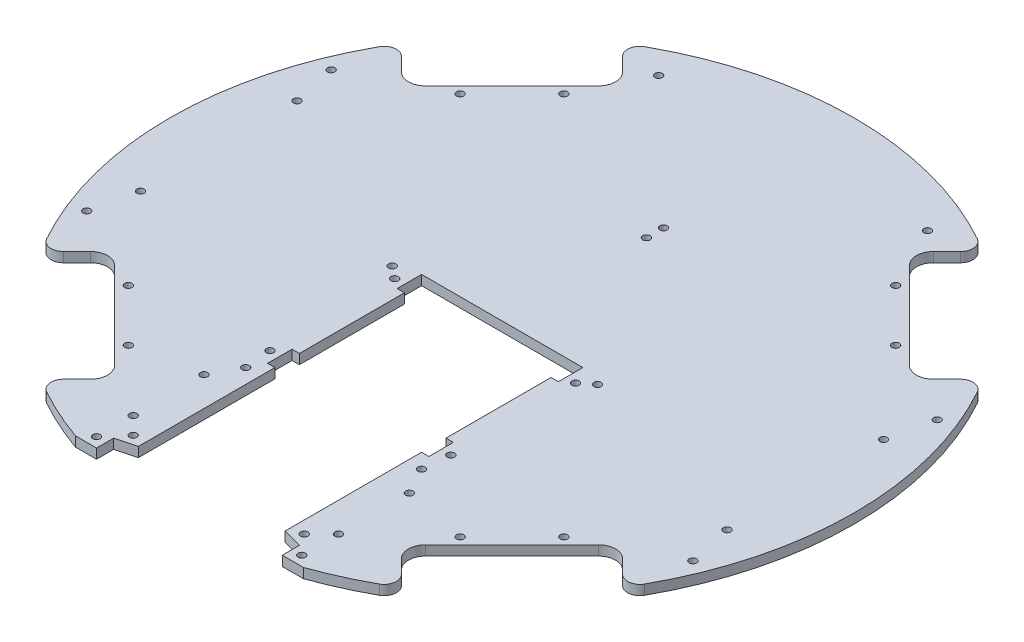
from build123d import *

# Parameters (mm, degrees)
SKETCH1_R                = 140
BOSS_EXTRUDE1_DEPTH      = 4
CUT_EXTRUDE4_REACH       = 200.03
CUT_EXTRUDE6_REACH       = 200.03
SKETCH9_R                = 1.5
FILLET1_R                = 5
CIRPATTERN1_COUNT        = 4
FILLET1_OF_CIRPATTERN1_R = 5
CUT_EXTRUDE1_REACH       = 200.03
FILLET3_R                = 1.5
CUT_EXTRUDE7_REACH       = 200.03
SKETCH10_R               = 1.5
CUT_EXTRUDE9_REACH       = 200.03
SKETCH13_R               = 1.5
CUT_EXTRUDE12_REACH      = 200.03
SKETCH16_R               = 1.5
CUT_EXTRUDE13_REACH      = 200.03
SKETCH17_R               = 1.5
CUT_EXTRUDE15_REACH      = 200.03
SKETCH19_R               = 1.5
CUT_EXTRUDE17_REACH      = 200.03
SKETCH21_R               = 1.5
CUT_EXTRUDE18_REACH      = 200.03
SKETCH22_R               = 1.5
CUT_EXTRUDE19_REACH      = 200.03
SKETCH23_R               = 1.5


with BuildPart() as part:
    # Sketch1 → Boss-Extrude1 (new body)
    with BuildSketch(Plane(origin=(0, 0, 0), x_dir=(1, 0, 0), z_dir=(0, 1, 0))):
        Circle(SKETCH1_R)
    extrude(amount=BOSS_EXTRUDE1_DEPTH)

    # Sketch7 → Cut-Extrude4 (cut, up to next)
    with BuildSketch(Plane(origin=(0, 4, 0), x_dir=(1, 0, 0), z_dir=(0, 1, 0)), mode=Mode.PRIVATE) as cut_extrude4_sk1:
        with BuildLine():
            Line((-99.030304705, -63.604254968), (-63.604254968, -99.030304705))
            ThreePointArc((-63.604254968, -99.030304705), (-61.568647097, -103.944696834), (-63.604254968, -108.859088964))
            Line((-63.604254968, -108.859088964), (-76.367532368, -121.622366364))
            Line((-76.367532368, -121.622366364), (-121.622366364, -76.367532368))
            Line((-121.622366364, -76.367532368), (-108.859088964, -63.604254968))
            ThreePointArc((-108.859088964, -63.604254968), (-103.944696834, -61.568647097), (-99.030304705, -63.604254968))
        make_face()
    cut_extrude4_tool1 = extrude(cut_extrude4_sk1.sketch, amount=-CUT_EXTRUDE4_REACH, mode=Mode.PRIVATE) & part.part
    cut_extrude4 = cut_extrude4_tool1.solids().sort_by_distance((-90.257735, 4, 90.257735))[0]
    add(cut_extrude4, mode=Mode.SUBTRACT)

    # Sketch9 → Cut-Extrude6 (cut, up to next)
    with BuildSketch(Plane(origin=(0, 4, 0), x_dir=(1, 0, 0), z_dir=(0, 1, 0)), mode=Mode.PRIVATE) as cut_extrude6_sk1:
        with Locations((-89.09545443, -67.882250994)):
            Circle(SKETCH9_R)
    cut_extrude6_tool1 = extrude(cut_extrude6_sk1.sketch, amount=-CUT_EXTRUDE6_REACH, mode=Mode.PRIVATE) & part.part
    # Sketch9 → Cut-Extrude6 (cut, up to next)
    with BuildSketch(Plane(origin=(0, 4, 0), x_dir=(1, 0, 0), z_dir=(0, 1, 0)), mode=Mode.PRIVATE) as cut_extrude6_sk2:
        with Locations((-67.882250994, -89.09545443)):
            Circle(SKETCH9_R)
    cut_extrude6_tool2 = extrude(cut_extrude6_sk2.sketch, amount=-CUT_EXTRUDE6_REACH, mode=Mode.PRIVATE) & part.part
    cut_extrude6_1 = cut_extrude6_tool1.solids().sort_by_distance((-89.095454, 4, 67.882251))[0]
    add(cut_extrude6_1, mode=Mode.SUBTRACT)
    cut_extrude6_2 = cut_extrude6_tool2.solids().sort_by_distance((-67.882251, 4, 89.095454))[0]
    add(cut_extrude6_2, mode=Mode.SUBTRACT)
    cut_extrude6 = cut_extrude6_1 + cut_extrude6_2  # Cut-Extrude6 as one shape, for the pattern or mirror that repeats it

    # Fillet1
    fillet1_edges = [part.edges().sort_by_distance(p)[0] for p in [
        (-73.746853427, 2, 119.001687423),
        (-119.001687423, 2, 73.746853427),
    ]]
    fillet(fillet1_edges, radius=FILLET1_R)

    # CirPattern1: Cut-Extrude4, Cut-Extrude6 ×4 about axis
    cirpattern1_axis = Axis((0, 4, 0), (0, 1, 0))
    add([cut_extrude4.rotate(cirpattern1_axis, i * 360 / CIRPATTERN1_COUNT) for i in range(1, CIRPATTERN1_COUNT)], mode=Mode.SUBTRACT)
    add([cut_extrude6.rotate(cirpattern1_axis, i * 360 / CIRPATTERN1_COUNT) for i in range(1, CIRPATTERN1_COUNT)], mode=Mode.SUBTRACT)

    # Fillet1 of CirPattern1
    fillet1_of_cirpattern1_edges = [part.edges().sort_by_distance(p)[0] for p in [
        (119.001687423, 2, 73.746853427),
        (73.746853427, 2, 119.001687423),
        (73.746853427, 2, -119.001687423),
        (119.001687423, 2, -73.746853427),
        (-119.001687423, 2, -73.746853427),
        (-73.746853427, 2, -119.001687423),
    ]]
    fillet(fillet1_of_cirpattern1_edges, radius=FILLET1_OF_CIRPATTERN1_R)

    # Sketch2 → Cut-Extrude1 (cut, up to next)
    with BuildSketch(Plane(origin=(0, 4, 0), x_dir=(1, 0, 0), z_dir=(0, 1, 0)), mode=Mode.PRIVATE) as cut_extrude1_sk1:
        Polygon((-46.647615159, -132), (-38, -132), (-38, -125), (-30, -122.856406461), (-30, -67), (-33, -67), (-33, -57), (-30, -57), (-30, -14), (-33, -14), (-33, -4), (33, -4), (33, -14), (30, -14), (30, -57), (33, -57), (33, -67), (30, -67), (30, -122.856406461), (38, -125), (38, -132), (46.647615159, -132), (46.647615159, -140), (-46.647615159, -140), align=None)
    cut_extrude1_tool1 = extrude(cut_extrude1_sk1.sketch, amount=-CUT_EXTRUDE1_REACH, mode=Mode.PRIVATE) & part.part
    add(cut_extrude1_tool1.solids().sort_by_distance((0, 4, 74.292867))[0], mode=Mode.SUBTRACT)

    # Fillet3
    fillet3_edges = [part.edges().sort_by_distance(p)[0] for p in [
        (67.882250994, 0, 90.59545443),
        (89.09545443, 0, 69.382250994),
        (90.59545443, 0, -67.882250994),
        (69.382250994, 0, -89.09545443),
        (-67.882250994, 0, -90.59545443),
        (-89.09545443, 0, -69.382250994),
        (-69.382250994, 0, 89.09545443),
        (-90.59545443, 0, 67.882250994),
    ]]
    fillet(fillet3_edges, radius=FILLET3_R)

    # Sketch10 → Cut-Extrude7 (cut, up to next)
    with BuildSketch(Plane(origin=(0, 4, 0), x_dir=(1, 0, 0), z_dir=(0, 1, 0)), mode=Mode.PRIVATE) as cut_extrude7_sk1:
        with Locations((-37, -62)):
            Circle(SKETCH10_R)
    cut_extrude7_tool1 = extrude(cut_extrude7_sk1.sketch, amount=-CUT_EXTRUDE7_REACH, mode=Mode.PRIVATE) & part.part
    # Sketch10 → Cut-Extrude7 (cut, up to next)
    with BuildSketch(Plane(origin=(0, 4, 0), x_dir=(1, 0, 0), z_dir=(0, 1, 0)), mode=Mode.PRIVATE) as cut_extrude7_sk2:
        with Locations((37, -62)):
            Circle(SKETCH10_R)
    cut_extrude7_tool2 = extrude(cut_extrude7_sk2.sketch, amount=-CUT_EXTRUDE7_REACH, mode=Mode.PRIVATE) & part.part
    # Sketch10 → Cut-Extrude7 (cut, up to next)
    with BuildSketch(Plane(origin=(0, 4, 0), x_dir=(1, 0, 0), z_dir=(0, 1, 0)), mode=Mode.PRIVATE) as cut_extrude7_sk3:
        with Locations((-37, -11)):
            Circle(SKETCH10_R)
    cut_extrude7_tool3 = extrude(cut_extrude7_sk3.sketch, amount=-CUT_EXTRUDE7_REACH, mode=Mode.PRIVATE) & part.part
    # Sketch10 → Cut-Extrude7 (cut, up to next)
    with BuildSketch(Plane(origin=(0, 4, 0), x_dir=(1, 0, 0), z_dir=(0, 1, 0)), mode=Mode.PRIVATE) as cut_extrude7_sk4:
        with Locations((37, -11)):
            Circle(SKETCH10_R)
    cut_extrude7_tool4 = extrude(cut_extrude7_sk4.sketch, amount=-CUT_EXTRUDE7_REACH, mode=Mode.PRIVATE) & part.part
    # Sketch10 → Cut-Extrude7 (cut, up to next)
    with BuildSketch(Plane(origin=(0, 4, 0), x_dir=(1, 0, 0), z_dir=(0, 1, 0)), mode=Mode.PRIVATE) as cut_extrude7_sk5:
        with Locations((-42, -7)):
            Circle(SKETCH10_R)
    cut_extrude7_tool5 = extrude(cut_extrude7_sk5.sketch, amount=-CUT_EXTRUDE7_REACH, mode=Mode.PRIVATE) & part.part
    # Sketch10 → Cut-Extrude7 (cut, up to next)
    with BuildSketch(Plane(origin=(0, 4, 0), x_dir=(1, 0, 0), z_dir=(0, 1, 0)), mode=Mode.PRIVATE) as cut_extrude7_sk6:
        with Locations((42, -7)):
            Circle(SKETCH10_R)
    cut_extrude7_tool6 = extrude(cut_extrude7_sk6.sketch, amount=-CUT_EXTRUDE7_REACH, mode=Mode.PRIVATE) & part.part
    add(cut_extrude7_tool1.solids().sort_by_distance((-37, 4, 62))[0], mode=Mode.SUBTRACT)
    add(cut_extrude7_tool2.solids().sort_by_distance((37, 4, 62))[0], mode=Mode.SUBTRACT)
    add(cut_extrude7_tool3.solids().sort_by_distance((-37, 4, 11))[0], mode=Mode.SUBTRACT)
    add(cut_extrude7_tool4.solids().sort_by_distance((37, 4, 11))[0], mode=Mode.SUBTRACT)
    add(cut_extrude7_tool5.solids().sort_by_distance((-42, 4, 7))[0], mode=Mode.SUBTRACT)
    add(cut_extrude7_tool6.solids().sort_by_distance((42, 4, 7))[0], mode=Mode.SUBTRACT)

    # Sketch13 → Cut-Extrude9 (cut, up to next)
    with BuildSketch(Plane(origin=(0, 4, 0), x_dir=(1, 0, 0), z_dir=(0, 1, 0)), mode=Mode.PRIVATE) as cut_extrude9_sk1:
        with Locations((-42, -84)):
            Circle(SKETCH13_R)
    cut_extrude9_tool1 = extrude(cut_extrude9_sk1.sketch, amount=-CUT_EXTRUDE9_REACH, mode=Mode.PRIVATE) & part.part
    # Sketch13 → Cut-Extrude9 (cut, up to next)
    with BuildSketch(Plane(origin=(0, 4, 0), x_dir=(1, 0, 0), z_dir=(0, 1, 0)), mode=Mode.PRIVATE) as cut_extrude9_sk2:
        with Locations((-42, -113)):
            Circle(SKETCH13_R)
    cut_extrude9_tool2 = extrude(cut_extrude9_sk2.sketch, amount=-CUT_EXTRUDE9_REACH, mode=Mode.PRIVATE) & part.part
    # Sketch13 → Cut-Extrude9 (cut, up to next)
    with BuildSketch(Plane(origin=(0, 4, 0), x_dir=(1, 0, 0), z_dir=(0, 1, 0)), mode=Mode.PRIVATE) as cut_extrude9_sk3:
        with Locations((42, -113)):
            Circle(SKETCH13_R)
    cut_extrude9_tool3 = extrude(cut_extrude9_sk3.sketch, amount=-CUT_EXTRUDE9_REACH, mode=Mode.PRIVATE) & part.part
    # Sketch13 → Cut-Extrude9 (cut, up to next)
    with BuildSketch(Plane(origin=(0, 4, 0), x_dir=(1, 0, 0), z_dir=(0, 1, 0)), mode=Mode.PRIVATE) as cut_extrude9_sk4:
        with Locations((42, -84)):
            Circle(SKETCH13_R)
    cut_extrude9_tool4 = extrude(cut_extrude9_sk4.sketch, amount=-CUT_EXTRUDE9_REACH, mode=Mode.PRIVATE) & part.part
    add(cut_extrude9_tool1.solids().sort_by_distance((-42, 4, 84))[0], mode=Mode.SUBTRACT)
    add(cut_extrude9_tool2.solids().sort_by_distance((-42, 4, 113))[0], mode=Mode.SUBTRACT)
    add(cut_extrude9_tool3.solids().sort_by_distance((42, 4, 113))[0], mode=Mode.SUBTRACT)
    add(cut_extrude9_tool4.solids().sort_by_distance((42, 4, 84))[0], mode=Mode.SUBTRACT)

    # Sketch16 → Cut-Extrude12 (cut, up to next)
    with BuildSketch(Plane(origin=(0, 4, 0), x_dir=(1, 0, 0), z_dir=(0, 1, 0)), mode=Mode.PRIVATE) as cut_extrude12_sk1:
        with Locations((0, 62)):
            Circle(SKETCH16_R)
    cut_extrude12_tool1 = extrude(cut_extrude12_sk1.sketch, amount=-CUT_EXTRUDE12_REACH, mode=Mode.PRIVATE) & part.part
    # Sketch16 → Cut-Extrude12 (cut, up to next)
    with BuildSketch(Plane(origin=(0, 4, 0), x_dir=(1, 0, 0), z_dir=(0, 1, 0)), mode=Mode.PRIVATE) as cut_extrude12_sk2:
        with Locations((0, 55)):
            Circle(SKETCH16_R)
    cut_extrude12_tool2 = extrude(cut_extrude12_sk2.sketch, amount=-CUT_EXTRUDE12_REACH, mode=Mode.PRIVATE) & part.part
    add(cut_extrude12_tool1.solids().sort_by_distance((0, 4, -62))[0], mode=Mode.SUBTRACT)
    add(cut_extrude12_tool2.solids().sort_by_distance((0, 4, -55))[0], mode=Mode.SUBTRACT)

    # Sketch17 → Cut-Extrude13 (cut, up to next)
    with BuildSketch(Plane(origin=(0, 4, 0), x_dir=(1, 0, 0), z_dir=(0, 1, 0)), mode=Mode.PRIVATE) as cut_extrude13_sk1:
        with Locations((-124, 50)):
            Circle(SKETCH17_R)
    cut_extrude13_tool1 = extrude(cut_extrude13_sk1.sketch, amount=-CUT_EXTRUDE13_REACH, mode=Mode.PRIVATE) & part.part
    # Sketch17 → Cut-Extrude13 (cut, up to next)
    with BuildSketch(Plane(origin=(0, 4, 0), x_dir=(1, 0, 0), z_dir=(0, 1, 0)), mode=Mode.PRIVATE) as cut_extrude13_sk2:
        with Locations((-124, -50)):
            Circle(SKETCH17_R)
    cut_extrude13_tool2 = extrude(cut_extrude13_sk2.sketch, amount=-CUT_EXTRUDE13_REACH, mode=Mode.PRIVATE) & part.part
    # Sketch17 → Cut-Extrude13 (cut, up to next)
    with BuildSketch(Plane(origin=(0, 4, 0), x_dir=(1, 0, 0), z_dir=(0, 1, 0)), mode=Mode.PRIVATE) as cut_extrude13_sk3:
        with Locations((124, 50)):
            Circle(SKETCH17_R)
    cut_extrude13_tool3 = extrude(cut_extrude13_sk3.sketch, amount=-CUT_EXTRUDE13_REACH, mode=Mode.PRIVATE) & part.part
    # Sketch17 → Cut-Extrude13 (cut, up to next)
    with BuildSketch(Plane(origin=(0, 4, 0), x_dir=(1, 0, 0), z_dir=(0, 1, 0)), mode=Mode.PRIVATE) as cut_extrude13_sk4:
        with Locations((124, -50)):
            Circle(SKETCH17_R)
    cut_extrude13_tool4 = extrude(cut_extrude13_sk4.sketch, amount=-CUT_EXTRUDE13_REACH, mode=Mode.PRIVATE) & part.part
    add(cut_extrude13_tool1.solids().sort_by_distance((-124, 4, -50))[0], mode=Mode.SUBTRACT)
    add(cut_extrude13_tool2.solids().sort_by_distance((-124, 4, 50))[0], mode=Mode.SUBTRACT)
    add(cut_extrude13_tool3.solids().sort_by_distance((124, 4, -50))[0], mode=Mode.SUBTRACT)
    add(cut_extrude13_tool4.solids().sort_by_distance((124, 4, 50))[0], mode=Mode.SUBTRACT)

    # Sketch19 → Cut-Extrude15 (cut, up to next)
    with BuildSketch(Plane(origin=(0, 4, 0), x_dir=(1, 0, 0), z_dir=(0, 1, 0)), mode=Mode.PRIVATE) as cut_extrude15_sk1:
        with Locations((-42, -128)):
            Circle(SKETCH19_R)
    cut_extrude15_tool1 = extrude(cut_extrude15_sk1.sketch, amount=-CUT_EXTRUDE15_REACH, mode=Mode.PRIVATE) & part.part
    # Sketch19 → Cut-Extrude15 (cut, up to next)
    with BuildSketch(Plane(origin=(0, 4, 0), x_dir=(1, 0, 0), z_dir=(0, 1, 0)), mode=Mode.PRIVATE) as cut_extrude15_sk2:
        with Locations((42, -128)):
            Circle(SKETCH19_R)
    cut_extrude15_tool2 = extrude(cut_extrude15_sk2.sketch, amount=-CUT_EXTRUDE15_REACH, mode=Mode.PRIVATE) & part.part
    add(cut_extrude15_tool1.solids().sort_by_distance((-42, 4, 128))[0], mode=Mode.SUBTRACT)
    add(cut_extrude15_tool2.solids().sort_by_distance((42, 4, 128))[0], mode=Mode.SUBTRACT)

    # Sketch21 → Cut-Extrude17 (cut, up to next)
    with BuildSketch(Plane(origin=(0, 4, 0), x_dir=(1, 0, 0), z_dir=(0, 1, 0)), mode=Mode.PRIVATE) as cut_extrude17_sk1:
        with Locations((-35, -120)):
            Circle(SKETCH21_R)
    cut_extrude17_tool1 = extrude(cut_extrude17_sk1.sketch, amount=-CUT_EXTRUDE17_REACH, mode=Mode.PRIVATE) & part.part
    # Sketch21 → Cut-Extrude17 (cut, up to next)
    with BuildSketch(Plane(origin=(0, 4, 0), x_dir=(1, 0, 0), z_dir=(0, 1, 0)), mode=Mode.PRIVATE) as cut_extrude17_sk2:
        with Locations((-36, -73)):
            Circle(SKETCH21_R)
    cut_extrude17_tool2 = extrude(cut_extrude17_sk2.sketch, amount=-CUT_EXTRUDE17_REACH, mode=Mode.PRIVATE) & part.part
    # Sketch21 → Cut-Extrude17 (cut, up to next)
    with BuildSketch(Plane(origin=(0, 4, 0), x_dir=(1, 0, 0), z_dir=(0, 1, 0)), mode=Mode.PRIVATE) as cut_extrude17_sk3:
        with Locations((35, -120)):
            Circle(SKETCH21_R)
    cut_extrude17_tool3 = extrude(cut_extrude17_sk3.sketch, amount=-CUT_EXTRUDE17_REACH, mode=Mode.PRIVATE) & part.part
    # Sketch21 → Cut-Extrude17 (cut, up to next)
    with BuildSketch(Plane(origin=(0, 4, 0), x_dir=(1, 0, 0), z_dir=(0, 1, 0)), mode=Mode.PRIVATE) as cut_extrude17_sk4:
        with Locations((36, -73)):
            Circle(SKETCH21_R)
    cut_extrude17_tool4 = extrude(cut_extrude17_sk4.sketch, amount=-CUT_EXTRUDE17_REACH, mode=Mode.PRIVATE) & part.part
    add(cut_extrude17_tool1.solids().sort_by_distance((-35, 4, 120))[0], mode=Mode.SUBTRACT)
    add(cut_extrude17_tool2.solids().sort_by_distance((-36, 4, 73))[0], mode=Mode.SUBTRACT)
    add(cut_extrude17_tool3.solids().sort_by_distance((35, 4, 120))[0], mode=Mode.SUBTRACT)
    add(cut_extrude17_tool4.solids().sort_by_distance((36, 4, 73))[0], mode=Mode.SUBTRACT)

    # Sketch22 → Cut-Extrude18 (cut, up to next)
    with BuildSketch(Plane(origin=(0, 4, 0), x_dir=(1, 0, 0), z_dir=(0, 1, 0)), mode=Mode.PRIVATE) as cut_extrude18_sk1:
        with Locations((120, 32)):
            Circle(SKETCH22_R)
    cut_extrude18_tool1 = extrude(cut_extrude18_sk1.sketch, amount=-CUT_EXTRUDE18_REACH, mode=Mode.PRIVATE) & part.part
    # Sketch22 → Cut-Extrude18 (cut, up to next)
    with BuildSketch(Plane(origin=(0, 4, 0), x_dir=(1, 0, 0), z_dir=(0, 1, 0)), mode=Mode.PRIVATE) as cut_extrude18_sk2:
        with Locations((120, -32)):
            Circle(SKETCH22_R)
    cut_extrude18_tool2 = extrude(cut_extrude18_sk2.sketch, amount=-CUT_EXTRUDE18_REACH, mode=Mode.PRIVATE) & part.part
    # Sketch22 → Cut-Extrude18 (cut, up to next)
    with BuildSketch(Plane(origin=(0, 4, 0), x_dir=(1, 0, 0), z_dir=(0, 1, 0)), mode=Mode.PRIVATE) as cut_extrude18_sk3:
        with Locations((-120, 32)):
            Circle(SKETCH22_R)
    cut_extrude18_tool3 = extrude(cut_extrude18_sk3.sketch, amount=-CUT_EXTRUDE18_REACH, mode=Mode.PRIVATE) & part.part
    # Sketch22 → Cut-Extrude18 (cut, up to next)
    with BuildSketch(Plane(origin=(0, 4, 0), x_dir=(1, 0, 0), z_dir=(0, 1, 0)), mode=Mode.PRIVATE) as cut_extrude18_sk4:
        with Locations((-120, -32)):
            Circle(SKETCH22_R)
    cut_extrude18_tool4 = extrude(cut_extrude18_sk4.sketch, amount=-CUT_EXTRUDE18_REACH, mode=Mode.PRIVATE) & part.part
    add(cut_extrude18_tool1.solids().sort_by_distance((120, 4, -32))[0], mode=Mode.SUBTRACT)
    add(cut_extrude18_tool2.solids().sort_by_distance((120, 4, 32))[0], mode=Mode.SUBTRACT)
    add(cut_extrude18_tool3.solids().sort_by_distance((-120, 4, -32))[0], mode=Mode.SUBTRACT)
    add(cut_extrude18_tool4.solids().sort_by_distance((-120, 4, 32))[0], mode=Mode.SUBTRACT)

    # Sketch23 → Cut-Extrude19 (cut, up to next)
    with BuildSketch(Plane(origin=(0, 4, 0), x_dir=(1, 0, 0), z_dir=(0, 1, 0)), mode=Mode.PRIVATE) as cut_extrude19_sk1:
        with Locations((-55, 115)):
            Circle(SKETCH23_R)
    cut_extrude19_tool1 = extrude(cut_extrude19_sk1.sketch, amount=-CUT_EXTRUDE19_REACH, mode=Mode.PRIVATE) & part.part
    # Sketch23 → Cut-Extrude19 (cut, up to next)
    with BuildSketch(Plane(origin=(0, 4, 0), x_dir=(1, 0, 0), z_dir=(0, 1, 0)), mode=Mode.PRIVATE) as cut_extrude19_sk2:
        with Locations((55, 115)):
            Circle(SKETCH23_R)
    cut_extrude19_tool2 = extrude(cut_extrude19_sk2.sketch, amount=-CUT_EXTRUDE19_REACH, mode=Mode.PRIVATE) & part.part
    add(cut_extrude19_tool1.solids().sort_by_distance((-55, 4, -115))[0], mode=Mode.SUBTRACT)
    add(cut_extrude19_tool2.solids().sort_by_distance((55, 4, -115))[0], mode=Mode.SUBTRACT)


solid = part.part
